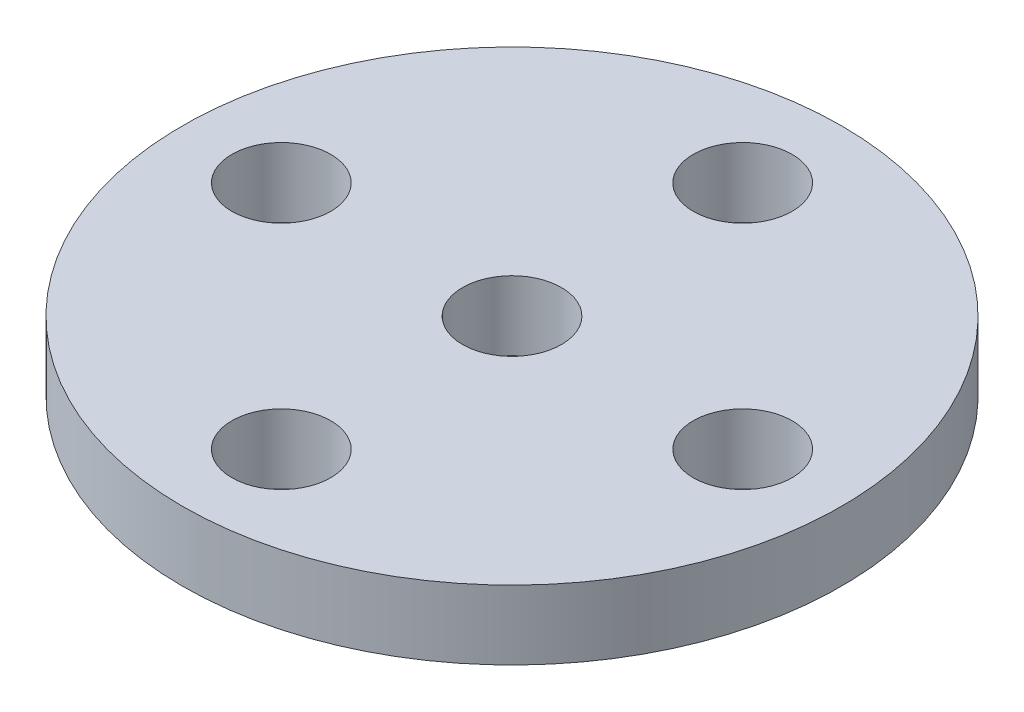
from build123d import *

# Parameters (mm, degrees)
SKETCH1_R           = 10
SKETCH1_R_2         = 1.5
BOSS_EXTRUDE1_DEPTH = 2.1


with BuildPart() as part:
    # Sketch1 → Boss-Extrude1 (new body)
    with BuildSketch(Plane(origin=(0, 0, 0), x_dir=(1, 0, 0), z_dir=(0, 1, 0))):
        Circle(SKETCH1_R)
        Circle(SKETCH1_R_2, mode=Mode.SUBTRACT)
        with Locations((0, 7)):
            Circle(SKETCH1_R_2, mode=Mode.SUBTRACT)
        with Locations((7, 0)):
            Circle(SKETCH1_R_2, mode=Mode.SUBTRACT)
        with Locations((0, -7)):
            Circle(SKETCH1_R_2, mode=Mode.SUBTRACT)
        with Locations((-7, 0)):
            Circle(SKETCH1_R_2, mode=Mode.SUBTRACT)
    extrude(amount=BOSS_EXTRUDE1_DEPTH)


solid = part.part
